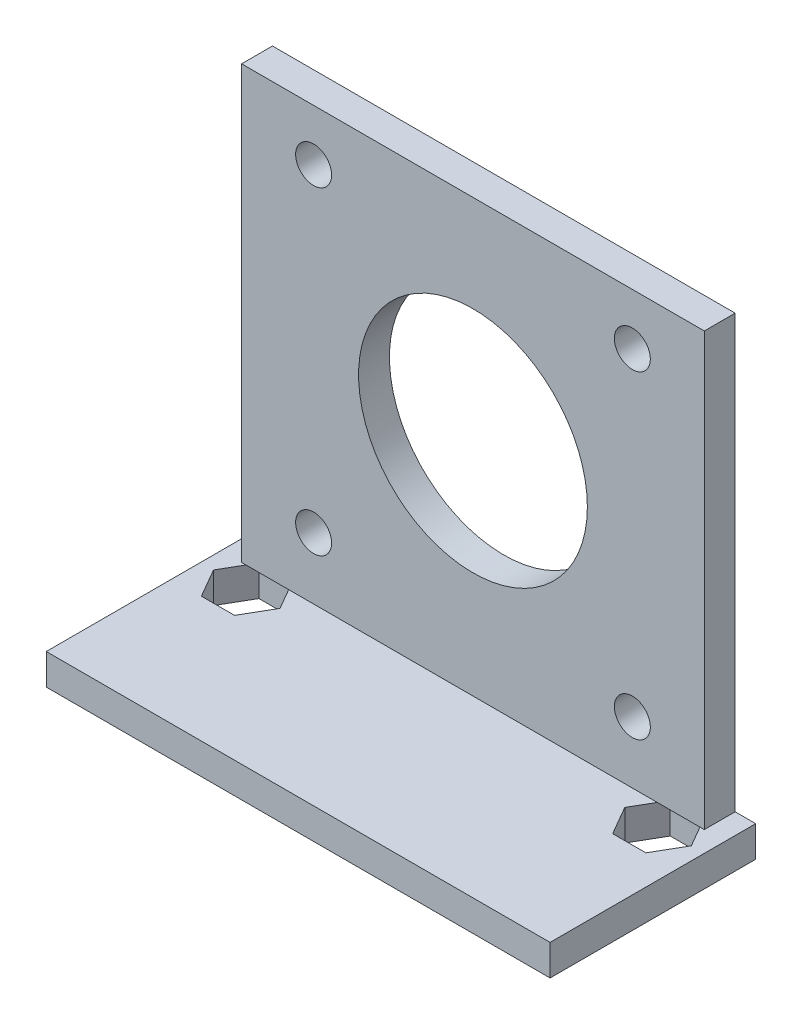
from build123d import *

# Parameters (mm, degrees)
ESQUISSE1_W        = 45
ESQUISSE1_H        = 42
ESQUISSE1_R        = 1.75
ESQUISSE1_R_2      = 11.125
BOSS_EXTRU_1_DEPTH = 3
BOSS_EXTRU_2_DEPTH = 3


with BuildPart() as part:
    # Esquisse1 → Boss.-Extru.1 (new body)
    with BuildSketch(Plane.XY):
        with Locations((15.5, 15)):
            Rectangle(ESQUISSE1_W, ESQUISSE1_H)
        with Locations((0, 31)):
            Circle(ESQUISSE1_R, mode=Mode.SUBTRACT)
        with Locations((31, 31)):
            Circle(ESQUISSE1_R, mode=Mode.SUBTRACT)
        with Locations((31, 0)):
            Circle(ESQUISSE1_R, mode=Mode.SUBTRACT)
        Circle(ESQUISSE1_R, mode=Mode.SUBTRACT)
        with Locations((15.5, 15.5)):
            Circle(ESQUISSE1_R_2, mode=Mode.SUBTRACT)
    extrude(amount=BOSS_EXTRU_1_DEPTH)

    # Esquisse3 → Boss.-Extru.2 (add)
    with BuildSketch(Plane.XZ.offset(6)):
        Polygon((-7, 20), (-9, 20), (-9, 0), (-7, 0), (38, 0), (40, 0), (40, 20), (38, 20), align=None)
        Polygon((-1.266838493, 5), (-2.883419246, 7.8), (-6.116580754, 7.8), (-7.733161507, 5), (-6.116580754, 2.2), (-2.883419246, 2.2), align=None, mode=Mode.SUBTRACT)
        Polygon((33.883419246, 2.2), (32.266838493, 5), (33.883419246, 7.8), (37.116580754, 7.8), (38.733161507, 5), (37.116580754, 2.2), align=None, mode=Mode.SUBTRACT)
    extrude(amount=BOSS_EXTRU_2_DEPTH)


solid = part.part
